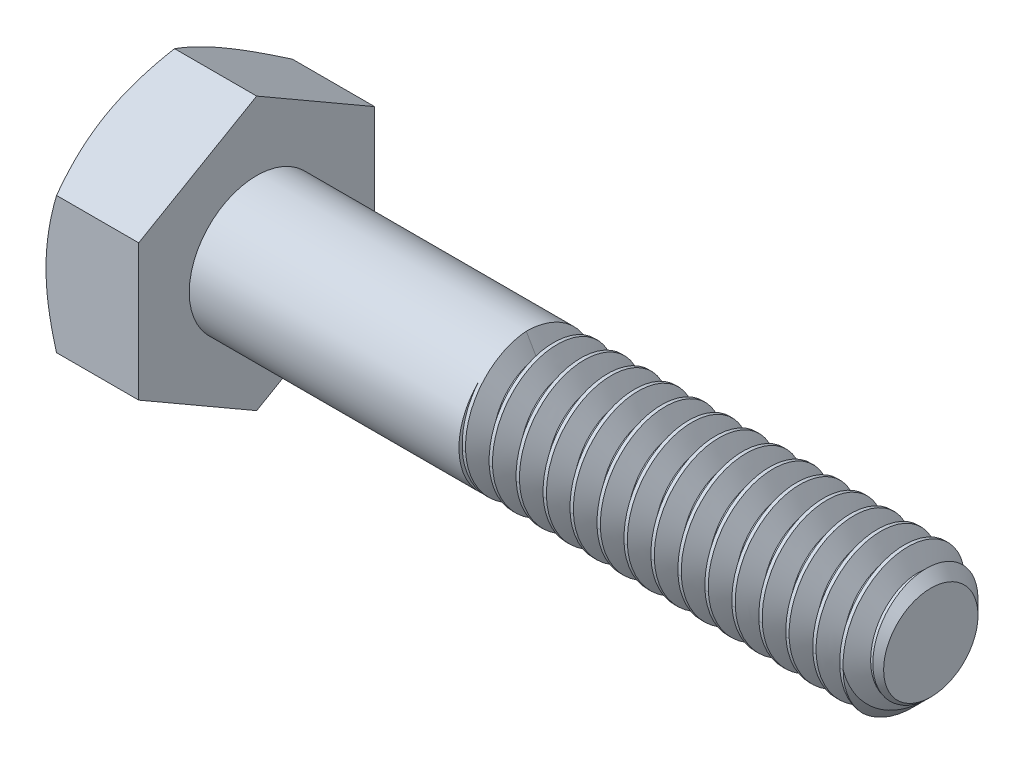
from build123d import *

# Parameters (mm, degrees)
SKETCH5_R           = 3.175
BOSS_EXTRUDE3_DEPTH = 31.75
CHAMFER1_SIZE       = 0.9525
BOSS_EXTRUDE4_DEPTH = 4.365625
SKETCH8_OUTSIDE_W   = 153.074
SKETCH8_OUTSIDE_H   = 154.794
SKETCH8_OUTSIDE_R   = 5.55625
CUT_EXTRUDE3_DEPTH  = 38.099499124
CUT_EXTRUDE3_DRAFT  = -60
CUT_EXTRUDE4_DEPTH  = 0.254
CIRPATTERN1_COUNT   = 6
CUT_SWEEP1_PITCH    = 1.27
CUT_SWEEP1_TO       = 19.05


with BuildPart() as part:
    # Sketch5 → Boss-Extrude3 (new body)
    with BuildSketch(Plane(origin=(18.0578125, 0, 0), x_dir=(0, 0, -1), z_dir=(1, 0, 0))):
        Circle(SKETCH5_R)
    extrude(amount=-BOSS_EXTRUDE3_DEPTH)

    # Chamfer1
    chamfer1_edges = [part.edges().sort_by_distance(p)[0] for p in [
        (18.0578125, 0, 3.175),
    ]]
    chamfer(chamfer1_edges, length=CHAMFER1_SIZE)

    # Sketch11 → Revolve1 (revolve)
    with BuildSketch(Plane.XY, mode=Mode.PRIVATE) as revolve1_sk:
        Polygon((-13.6921875, 3.175), (-13.6921875, 0), (2.1828125, 0), (-0.9921875, 3.175), align=None)
    revolve(revolve1_sk.sketch.rotate(Axis((-13.6921875, 0, 0), (1, 0, 0)), 90), axis=Axis((-13.6921875, 0, 0), (1, 0, 0)))

    # Sketch6 → Boss-Extrude4 (add)
    with BuildSketch(Plane.ZY.offset(13.6921875)):
        Polygon((5.55625, 3.207902433), (0, 6.415804866), (-5.55625, 3.207902433), (-5.55625, -3.207902433), (0, -6.415804866), (5.55625, -3.207902433), align=None)
    extrude(amount=BOSS_EXTRUDE4_DEPTH)


with BuildPart() as cut_extrude3_tool:
    # Sketch8 outside → Cut-Extrude3 (with draft: the straight prism first)
    with BuildSketch(Plane.ZY.offset(18.0578125)):
        Rectangle(SKETCH8_OUTSIDE_W, SKETCH8_OUTSIDE_H)
        Circle(SKETCH8_OUTSIDE_R, mode=Mode.SUBTRACT)
    extrude(amount=-CUT_EXTRUDE3_DEPTH)
    # Cut-Extrude3: the draft: its side faces are tilted about the plane it starts from
    cut_extrude3_sides = [cut_extrude3_tool.faces().sort_by_distance(p)[0] for p in [
        (0.991937062, -77.397, 0),
        (0.991937062, 0, 76.537),
        (0.991937062, 77.397, 0),
        (0.991937062, 0, -76.537),
        (0.991937062, 0, -5.55625),
    ]]
    draft(cut_extrude3_sides, Plane.ZY.offset(18.0578125), CUT_EXTRUDE3_DRAFT)


with BuildPart() as part_1:
    add(part.part)

    # Cut-Extrude3: cut by cut_extrude3_tool
    add(cut_extrude3_tool.part, mode=Mode.SUBTRACT)

    # Sketch12 → Cut-Extrude4 (cut)
    with BuildSketch(Plane.ZY.offset(18.0578125)):
        with BuildLine():
            Line((0.1666875, 4.2783125), (0.1666875, 2.3891875))
            ThreePointArc((0.1666875, 2.3891875), (0, 2.2225), (-0.1666875, 2.3891875))
            Line((-0.1666875, 2.3891875), (-0.1666875, 4.2783125))
            ThreePointArc((-0.1666875, 4.2783125), (0, 4.445), (0.1666875, 4.2783125))
        make_face()
    cut_extrude4 = extrude(amount=-CUT_EXTRUDE4_DEPTH, mode=Mode.SUBTRACT)

    # CirPattern1: Cut-Extrude4 ×6 about axis
    cirpattern1_axis = Axis((0, 0, 0), (1, 0, 0))
    for i in range(1, CIRPATTERN1_COUNT):
        add(cut_extrude4.rotate(cirpattern1_axis, i * 360 / CIRPATTERN1_COUNT), mode=Mode.SUBTRACT)


with BuildPart() as body_2:
    # Split1: the piece on the far side of the plane
    add(part_1.part)
    split(bisect_by=Plane(origin=(-0.9921875, 0, 0), x_dir=(0, 0, 1), z_dir=(1, 0, 0)), keep=Keep.BOTTOM)


with BuildPart() as part_2:
    add(part_1.part)

    # Split1
    split(bisect_by=Plane(origin=(-0.9921875, 0, 0), x_dir=(0, 0, 1), z_dir=(1, 0, 0)), keep=Keep.TOP)

    # Cut-Sweep1: arcs per turn and ends read off the stored shape
    # Cut-Sweep1: the profile of Sketch10 profile screwed along a right-hand helix through 16 turns, 8 arcs to a turn; built about Z, then put on its axis
    cut_sweep1_z = Axis((0, 0, 0), (0, 0, 1))
    cut_sweep1_corners = [(3.1753, 0, 0.000173205), (2.350110803, 0, -0.47625), (2.350110803, 0, -0.635), (3.1753, 0, -1.111423205)]
    with BuildLine(mode=Mode.PRIVATE) as cut_sweep1_profile:
        Line(cut_sweep1_corners[0], cut_sweep1_corners[1])
        Line(cut_sweep1_corners[1], cut_sweep1_corners[2])
        Line(cut_sweep1_corners[2], cut_sweep1_corners[3])
        Line(cut_sweep1_corners[3], cut_sweep1_corners[0])
    cut_sweep1_cap = Face(cut_sweep1_profile.wire())
    cut_sweep1_turn_angles = [0, 22.5, 45, 67.5, 90, 112.5, 135, 157.5, 180, 202.5, 225, 247.5, 270, 292.5, 315, 337.5, 360]
    cut_sweep1_turn_weights = [1, 0.9238795325112867, 1, 0.9238795325112867, 1, 0.9238795325112867, 1, 0.9238795325112867, 1, 0.9238795325112867, 1, 0.9238795325112867, 1, 0.9238795325112867, 1, 0.9238795325112867, 1]
    cut_sweep1_turn_rails = [Edge.make_bspline([Vector(p[0], p[1], 0).rotate(cut_sweep1_z, cut_sweep1_turn_angles[k]) / cut_sweep1_turn_weights[k] + Vector(0, 0, p[2] + CUT_SWEEP1_PITCH * cut_sweep1_turn_angles[k] / 360) for k in range(17)], [0, 0, 0, 1, 1, 2, 2, 3, 3, 4, 4, 5, 5, 6, 6, 7, 7, 8, 8, 8], 2, cut_sweep1_turn_weights) for p in cut_sweep1_corners]
    cut_sweep1_turn_sides = [Face.make_surface_from_curves(cut_sweep1_turn_rails[p[0]], cut_sweep1_turn_rails[p[1]]) for p in [(0, 1), (1, 2), (2, 3), (3, 0)]]
    cut_sweep1 = Plane(origin=(18.0578125, 0, 0), x_dir=(0, 1, 0), z_dir=(-1, 0, 0)) * split(Solid(Shell([*[p.moved(Location((0, 0, CUT_SWEEP1_PITCH * i))) for i in range(16) for p in cut_sweep1_turn_sides], cut_sweep1_cap, cut_sweep1_cap.rotate(cut_sweep1_z, 5760).moved(Location((0, 0, CUT_SWEEP1_PITCH * 5760 / 360)))])), bisect_by=Plane.XY.offset(CUT_SWEEP1_TO), keep=Keep.BOTTOM, mode=Mode.PRIVATE)
    add(cut_sweep1, mode=Mode.SUBTRACT)


with BuildPart() as boss_extrude5_tool:
    # Boss-Extrude5: read off the stored shape, not the designer's step
    # Boss-Extrude5 outline → Boss-Extrude5 (revolve)
    with BuildSketch(Plane.YX):
        Polygon((3.175, -0.9921875), (2.35010135, -0.515932042), (2.35010135, -0.9921875), align=None)
    revolve(axis=Axis((0, 0, 0), (1, 0, 0)))


with BuildPart() as part_3:
    add(part_2.part)


with BuildPart() as part_4:
    # Boss-Extrude5: joined with boss_extrude5_tool
    add(part_3.part.fuse(boss_extrude5_tool.part, body_2.part, tol=0.00001))


solid = part_4.part
